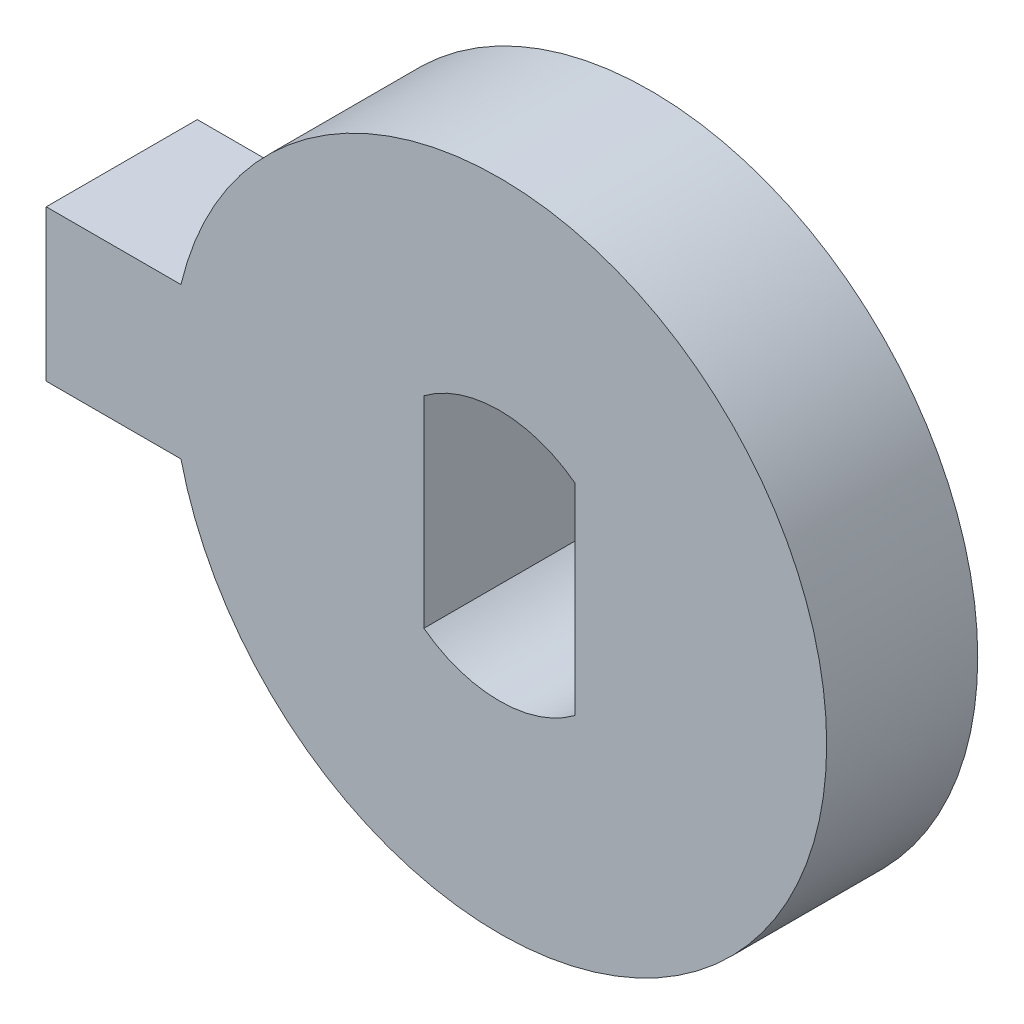
from build123d import *

# Parameters (mm, degrees)
EXTRUDE_1_DEPTH = 3


with BuildPart() as part:
    # Эскиз1 → Бобышка-Вытянуть1 (new body)
    with BuildSketch(Plane.XY):
        with BuildLine():
            Line((-9, 1.5), (-6.32455532, 1.5))
            ThreePointArc((-6.32455532, 1.5), (6.5, 0), (-6.32455532, -1.5))
            Line((-6.32455532, -1.5), (-9, -1.5))
            Line((-9, -1.5), (-9, 1.5))
        make_face()
        with BuildLine():
            Line((-1.5, 0), (-1.5, 2))
            ThreePointArc((-1.5, 2), (0, 2.5), (1.5, 2))
            Line((1.5, 2), (1.5, -2))
            ThreePointArc((1.5, -2), (0, -2.5), (-1.5, -2))
            Line((-1.5, -2), (-1.5, 0))
        make_face(mode=Mode.SUBTRACT)
    extrude(amount=EXTRUDE_1_DEPTH)


solid = part.part
